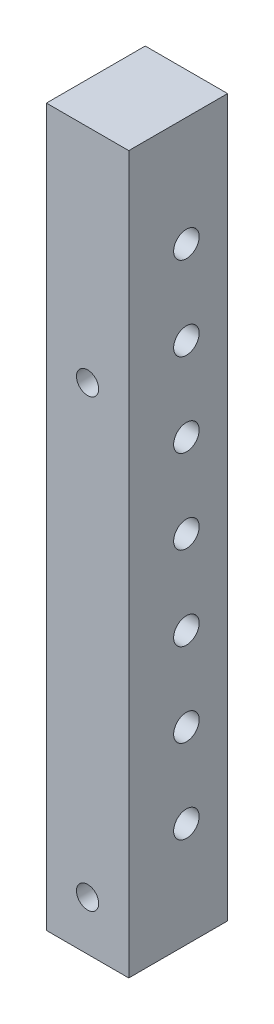
from build123d import *

# Parameters (mm, degrees)
SKETCH_1_W              = 10
SKETCH_1_H              = 12
EXTRUDE_1_DEPTH         = 87
HOLE_WIZARD_3_1_3_1_1_D = 3.1
HOLE_WIZARD_2_7_2_7_1_D = 2.7
HOLE_WIZARD_3_1_3_1_2_D = 3.1


with BuildPart() as part:
    # 草圖1 → 填料-伸長1 (new body)
    with BuildSketch(Plane(origin=(0, 0, 0), x_dir=(1, 0, 0), z_dir=(0, 1, 0))):
        Rectangle(SKETCH_1_W, SKETCH_1_H)
    extrude(amount=EXTRUDE_1_DEPTH)

    # Ø3.1 (3.1) 直徑孔1 (through all)
    with Locations(Plane(origin=(-5, 53.37, -1), x_dir=(0, 0, -1), z_dir=(-1, 0, 0))):
        with Locations((0, 0), (0, 20.32), (0, 40.64), (0, -20.32)):
            Hole(HOLE_WIZARD_3_1_3_1_1_D / 2)

    # Ø2.7 (2.7) 直徑孔1 (through all)
    with Locations(Plane(origin=(0, 60.1, -6), x_dir=(-1, 0, 0), z_dir=(0, 0, -1))):
        with Locations((0, 0), (0, -54.1)):
            Hole(HOLE_WIZARD_2_7_2_7_1_D / 2)

    # Ø3.1 (3.1) 直徑孔2 (through all)
    with Locations(Plane(origin=(-5, 63.53, -1), x_dir=(0, 0, -1), z_dir=(-1, 0, 0))):
        with Locations((0, 0), (0, 20.32), (0, 40.64)):
            Hole(HOLE_WIZARD_3_1_3_1_2_D / 2)


solid = part.part
